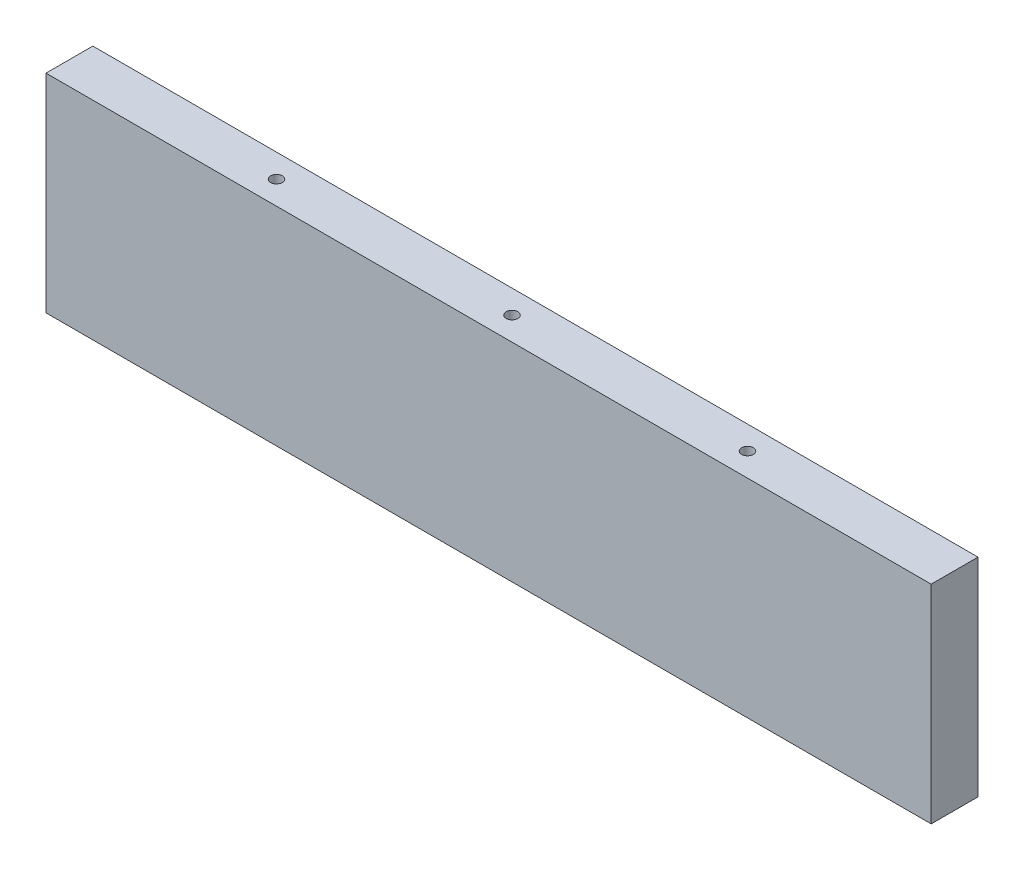
from build123d import *

# Parameters (mm, degrees)
SKETCH1_W           = 214.599999988
SKETCH1_H           = 56.3
BOSS_EXTRUDE1_DEPTH = 12.7
SKETCH3_W           = 12.7
SKETCH3_H           = 56.3
BOSS_EXTRUDE2_DEPTH = 12.7
SKETCH4_W           = 12.7
SKETCH4_H           = 56.3
BOSS_EXTRUDE3_DEPTH = 12.7
HOLE2_D             = 3.175
HOLE2_DEPTH         = 31.75
HOLE2_CSINK_D       = 10.16
HOLE2_CSINK_ANGLE   = 82
HOLE2_TIP           = 0.953866233
HOLE3_D             = 3.175
HOLE3_DEPTH         = 31.75
HOLE3_CSINK_D       = 10.16
HOLE3_CSINK_ANGLE   = 82
HOLE3_TIP           = 0.953866233


with BuildPart() as part:
    # Sketch1 → Boss-Extrude1 (new body)
    with BuildSketch(Plane.XY):
        with Locations((-124.004465969, 40.85)):
            Rectangle(SKETCH1_W, SKETCH1_H)
    extrude(amount=-BOSS_EXTRUDE1_DEPTH)

    # Sketch3 → Boss-Extrude2 (add)
    with BuildSketch(Plane.ZY.offset(231.304465963)):
        with Locations((-6.35, 40.85)):
            Rectangle(SKETCH3_W, SKETCH3_H)
    extrude(amount=BOSS_EXTRUDE2_DEPTH)

    # Sketch4 → Boss-Extrude3 (add)
    with BuildSketch(Plane(origin=(-16.704465975, 0, 0), x_dir=(0, 0, -1), z_dir=(1, 0, 0))):
        with Locations((6.35, 40.85)):
            Rectangle(SKETCH4_W, SKETCH4_H)
    extrude(amount=BOSS_EXTRUDE3_DEPTH)

    # Hole2
    with Locations(Plane(origin=(-124.004465969, 88.05, 66.124290059), x_dir=(1, 0, 0), z_dir=(0, 1, 0))):
        with Locations((-162.299999994, -97.525709941), (-113.649999994, -38.742376608), (-113.649999994, 13.690956725), (162.299999994, -97.525709941), (113.649999994, -38.742376608), (113.649999994, 13.690956725), (63.85, 72.474290059), (0, 72.474290059), (-63.85, 72.474290059)):
            CounterSinkHole(HOLE2_D / 2, HOLE2_CSINK_D / 2, depth=HOLE2_DEPTH, counter_sink_angle=HOLE2_CSINK_ANGLE)
            with Locations((0, 0, -(HOLE2_DEPTH + HOLE2_TIP / 2))):  # 118° drill point
                Cone(0, HOLE2_D / 2, HOLE2_TIP, mode=Mode.SUBTRACT)

    # Hole3
    with Locations(Plane(origin=(-124.004465969, 0, 66.124290059), x_dir=(-1, 0, 0), z_dir=(0, -1, 0))):
        with Locations((113.649999994, 39.907623392), (113.649999994, -64.959043275), (-94.599999994, 72.474290059), (94.599999994, 72.474290059), (0, 72.474290059), (0, 104.224290059), (0, 351.653783621), (0, 213.070350905), (40.979166666, 213.070350905), (166.795833328, 213.070350905), (207.774999994, 351.653783621), (207.774999994, 244.12141023), (207.774999994, 136.58903684), (207.774999994, 48.524290059), (207.774999994, -78.475709941), (-207.774999994, -78.475709941), (-207.774999994, 48.524290059), (-207.774999994, 136.58903684), (-207.774999994, 244.12141023), (-207.774999994, 351.653783621), (-166.795833328, 213.070350905), (-40.979166666, 213.070350905), (-113.649999994, -64.959043275), (-113.649999994, 39.907623392), (119.722999994, 109.705350905), (119.722999994, 182.730350905), (18.122999994, 109.705350905), (18.122999994, 182.730350905)):
            CounterSinkHole(HOLE3_D / 2, HOLE3_CSINK_D / 2, depth=HOLE3_DEPTH, counter_sink_angle=HOLE3_CSINK_ANGLE)
            with Locations((0, 0, -(HOLE3_DEPTH + HOLE3_TIP / 2))):  # 118° drill point
                Cone(0, HOLE3_D / 2, HOLE3_TIP, mode=Mode.SUBTRACT)


solid = part.part
